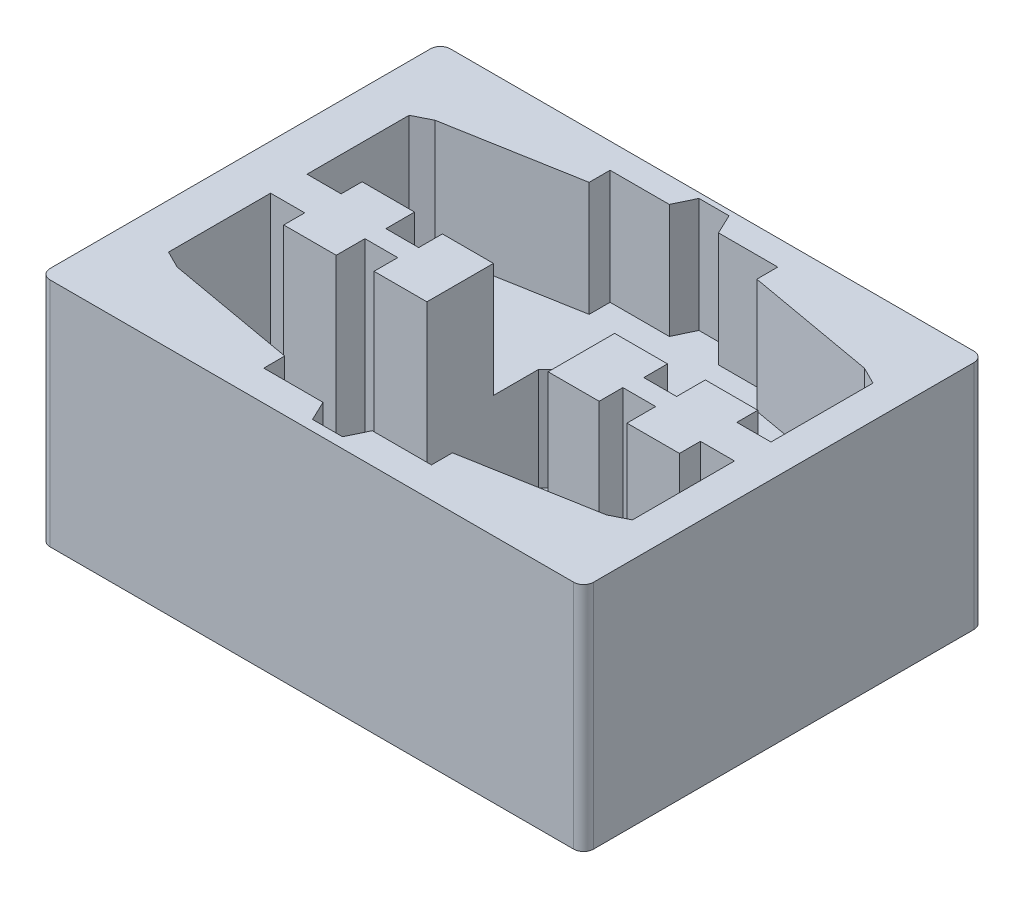
from build123d import *

# Parameters (mm, degrees)
SKETCH1_W             = 109.3
SKETCH1_H             = 80.5
BOSS_EXTRUDE3_DEPTH   = 46.5
FILLET2_R             = 2
FILLET3_R             = 2
FILLET4_R             = 2
FILLET5_R             = 2
K_WING_BLANK_START    = -12.90763076
K_WING_BLANK_DEPTH    = 23
BODY_MOVE_COPY6_ANGLE = 180
SKETCH5_W             = 6.556087763
SKETCH5_H             = 11.400081804
SKETCH5_W_2           = 6.270941902
SKETCH5_H_2           = 9.38377574
SKETCH5_W_3           = 6.195597691
CUT_EXTRUDE3_DEPTH    = 44
CUT_EXTRUDE4_DEPTH    = 21
FILLET7_R             = 2
SKETCH8_W             = 5.062019344
SKETCH8_H             = 2
SKETCH8_W_2           = 2.577509977
BOSS_EXTRUDE5_DEPTH   = 44


with BuildPart() as part:
    # Sketch1 → Boss-Extrude3 (new body)
    with BuildSketch(Plane(origin=(0, 0, 0), x_dir=(1, 0, 0), z_dir=(0, 1, 0))):
        with Locations((54.65, 40.25)):
            Rectangle(SKETCH1_W, SKETCH1_H)
    extrude(amount=BOSS_EXTRUDE3_DEPTH)

    # Fillet2
    fillet2_edges = [part.edges().sort_by_distance(p)[0] for p in [
        (109.3, 23.25, 0),
    ]]
    fillet(fillet2_edges, radius=FILLET2_R)

    # Fillet3
    fillet3_edges = [part.edges().sort_by_distance(p)[0] for p in [
        (0, 23.25, 0),
    ]]
    fillet(fillet3_edges, radius=FILLET3_R)

    # Fillet4
    fillet4_edges = [part.edges().sort_by_distance(p)[0] for p in [
        (109.3, 23.25, -80.5),
    ]]
    fillet(fillet4_edges, radius=FILLET4_R)

    # Fillet5
    fillet5_edges = [part.edges().sort_by_distance(p)[0] for p in [
        (0, 23.25, -80.5),
    ]]
    fillet(fillet5_edges, radius=FILLET5_R)


with BuildPart() as body_2:
    # K-Wing_Blank: read off the stored shape, not the designer's step
    # K-Wing_Blank outline → K-Wing_Blank (new body)
    with BuildSketch(Plane(origin=(0, 0, 0), x_dir=(1, 0, 0), z_dir=(0, 1, 0)).offset(K_WING_BLANK_START)):
        Polygon((-105.401168796, 111.360944086), (-105.401168796, 90.831282342), (-98.543704187, 90.831282342), (-98.543704187, 95.047195022), (-87.987616423, 95.047195022), (-87.987616423, 89.273227656), (-81.388796577, 89.273227656), (-81.388796577, 94.03904199), (-70.757364602, 94.03904199), (-70.757364602, 71.584724457), (-64.053188187, 64.880548042), (-53.449168798, 64.880548042), (-46.744992383, 71.584724457), (-46.744992383, 94.03904199), (-36.113560409, 94.03904199), (-36.113560409, 89.273227656), (-29.514740562, 89.273227656), (-29.514740562, 95.047195022), (-18.958652799, 95.047195022), (-18.958652799, 90.831282342), (-12.10118819, 90.831282342), (-12.10118819, 111.360944086), (-15.583898664, 113.102299324), (-41.887527774, 117.776463381), (-41.887527774, 121.992376061), (-53.802063608, 121.992376061), (-55.726719397, 126.024988189), (-61.775637589, 126.024988189), (-63.700293378, 121.992376061), (-75.614829211, 121.992376061), (-75.614829211, 117.776463381), (-101.918458321, 113.102299324), align=None)
    extrude(amount=K_WING_BLANK_DEPTH)


with BuildPart() as body_2_1:
    # Body-Move/Copy2: read off the stored shape, not the designer's step
    # Body-Move/Copy2: moved
    add(body_2.part.moved(Location((0, 36.4076308, 0))))


with BuildPart() as body_3:
    # Body-Move/Copy3: copy of body 2
    add(body_2_1.part.moved(Location((114.823678212, 0, 43.931811975))))


with BuildPart() as body_4:
    # Body-Move/Copy4: copy of body 2
    add(body_2_1.part.moved(Location((0, 20.633658037, 0))))


with BuildPart() as body_2_2:
    add(body_2_1.part)

    # Combine1: union body 4
    add(body_4.part)


with BuildPart() as body_2_3:
    # Body-Move/Copy6: moved
    add(body_2_2.part.rotate(Axis((-58.751178493, 0, -95.452768116), (0, 1, 0)), BODY_MOVE_COPY6_ANGLE))


with BuildPart() as body_2_4:
    # Body-Move/Copy8: moved
    add(body_2_3.part.moved(Location((114.46318814, 0, 60.098511736))))


with BuildPart() as body_3_1:
    # Body-Move/Copy9: moved
    add(body_3.part.moved(Location((0, 0, 2.643287199))))


with BuildPart() as body_2_5:
    # Body-Move/Copy10: moved
    add(body_2_4.part.moved(Location((0, 0, 2.68781543))))


with BuildPart() as body_2_6:
    # Body-Move/Copy11: read off the stored shape, not the designer's step
    # Body-Move/Copy11: moved
    add(body_2_5.part.moved(Location((0, -20.633658, 0))))


with BuildPart() as part_1:
    add(part.part)

    # Intersect3: read off the stored shape, not the designer's step
    # Intersect3: cut body 2, body 3
    add(body_2_6.part, mode=Mode.SUBTRACT)
    add(body_3_1.part, mode=Mode.SUBTRACT)

    # Sketch5 → Cut-Extrude3 (cut)
    with BuildSketch(Plane(origin=(0, 0, 0), x_dir=(-1, 0, 0), z_dir=(0, -1, 0))):
        Polygon((-63.428440073, 77.417276886), (-63.428440073, 78.5), (-107.3, 78.5), (-107.3, 2), (-62.771429167, 2), (-62.771429167, 4.292909509), (-74.575660365, 4.292909509), (-74.575660365, 8.66681439), (-104.722490023, 13.780837435), (-104.722490023, 68.336423007), (-76.04307152, 72.680595238), (-76.04307152, 77.417276886), align=None)
        with Locations((-21.558017908, 40.772054945)):
            Rectangle(SKETCH5_W, SKETCH5_H)
        with Locations((-38.570352587, 40.772054945)):
            Rectangle(SKETCH5_W_2, SKETCH5_H_2)
        with Locations((-73.21415678, 40.772054945)):
            Rectangle(SKETCH5_W_2, SKETCH5_H_2)
        with Locations((-90.406736496, 40.772054945)):
            Rectangle(SKETCH5_W_3, SKETCH5_H)
        Polygon((-49.906036037, 78.5), (-49.906036037, 77.417276886), (-37.208849001, 77.417276886), (-37.208849001, 72.8772955), (-7.062019344, 68.336423007), (-7.062019344, 13.610599493), (-36.848358928, 8.66681439), (-36.848358928, 4.292909509), (-49.238580109, 4.292909509), (-49.238580109, 2), (-2, 2), (-2, 78.5), align=None)
    extrude(amount=-CUT_EXTRUDE3_DEPTH, mode=Mode.SUBTRACT)

    # Sketch6 → Cut-Extrude4 (cut)
    with BuildSketch(Plane(origin=(0, 0, 0), x_dir=(-1, 0, 0), z_dir=(0, -1, 0))):
        Polygon((-41.705823538, 40.845981409), (-7.062019344, 40.845981409), (-7.062019344, 68.336423007), (-37.208849001, 72.8772955), (-37.208849001, 77.417276886), (-76.04307152, 77.417276886), (-76.04307152, 72.680595238), (-104.722490023, 68.336423007), (-104.722490023, 40.845981409), (-70.078685829, 40.845981409), (-70.078685829, 57.00242166), (-61.842446466, 65.238661023), (-49.581572828, 65.238661023), (-41.705823538, 57.362911733), align=None)
    extrude(amount=-CUT_EXTRUDE4_DEPTH, mode=Mode.SUBTRACT)

    # Fillet7
    fillet7_edges = [part_1.edges().sort_by_distance(p)[0] for p in [
        (107.3, 22, -2),
        (107.3, 22, -78.5),
        (2, 22, -78.5),
        (2, 22, -2),
    ]]
    fillet(fillet7_edges, radius=FILLET7_R)

    # Sketch8 → Boss-Extrude5 (add)
    with BuildSketch(Plane(origin=(0, 0, 0), x_dir=(-1, 0, 0), z_dir=(0, -1, 0))):
        with Locations((-4.531009672, 39.845981409)):
            Rectangle(SKETCH8_W, SKETCH8_H)
        with Locations((-106.011245012, 39.845981409)):
            Rectangle(SKETCH8_W_2, SKETCH8_H)
    extrude(amount=-BOSS_EXTRUDE5_DEPTH)


solid = part_1.part
